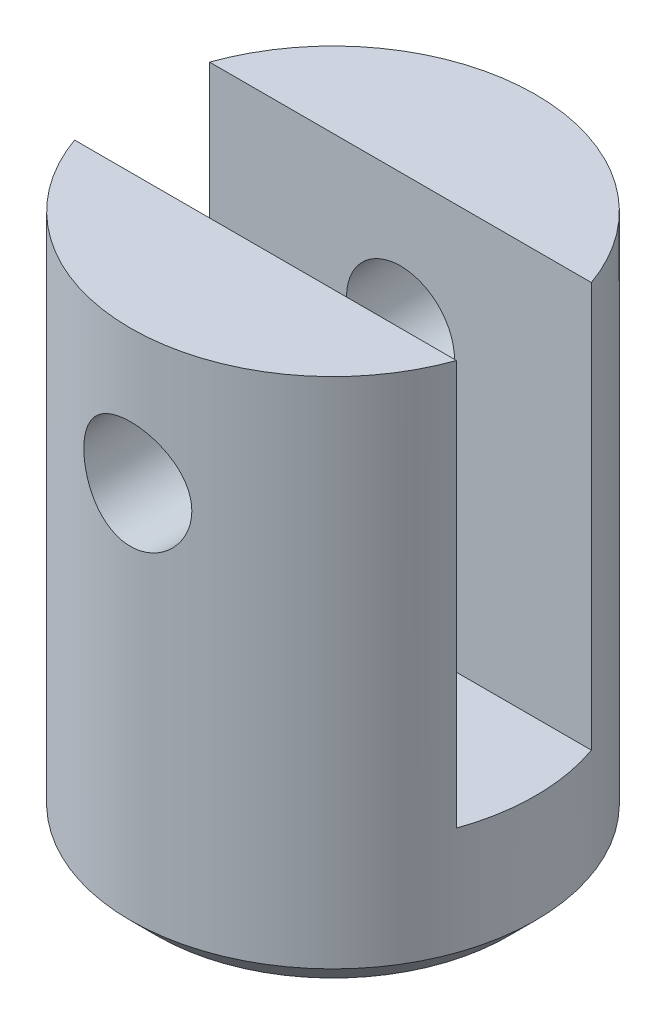
from build123d import *

# Parameters (mm, degrees)
ESBO_O1_R                  = 7.5
RESSALTO_EXTRUS_O1_DEPTH   = 10
CORTE_EXTRUS_O1_DEPTH      = 15.577379737
CORTE_EXTRUS_O1_DEPTH_BACK = 15.577379737
ESBO_O2_W                  = 5
ESBO_O2_H                  = 15
CORTE_EXTRUS_O2_DEPTH      = 15.577379737
CORTE_EXTRUS_O2_DEPTH_BACK = 15.577379737
ESBO_O3_R                  = 2
CHANFRO1_SIZE              = 1


with BuildPart() as part:
    # Esboço1 → Ressalto-extrusão1 (new, symmetric)
    with BuildSketch(Plane(origin=(0, 0, 0), x_dir=(1, 0, 0), z_dir=(0, 1, 0))):
        Circle(ESBO_O1_R)
    extrude(amount=RESSALTO_EXTRUS_O1_DEPTH, both=True)

    # Esboço2 → Corte-extrusão1 (cut, two sides: drawn at the far end of the back side and taken through both)
    with BuildSketch(Plane(origin=(0, 0, 0), x_dir=(0, 0, -1), z_dir=(1, 0, 0)).offset(-CORTE_EXTRUS_O1_DEPTH_BACK)):
        with Locations((0, 2.5)):
            Rectangle(ESBO_O2_W, ESBO_O2_H)
    extrude(amount=CORTE_EXTRUS_O1_DEPTH + CORTE_EXTRUS_O1_DEPTH_BACK, mode=Mode.SUBTRACT)

    # Esboço3 → Corte-extrusão2 (cut, two sides: drawn at the far end of the back side and taken through both)
    with BuildSketch(Plane.XY.offset(-CORTE_EXTRUS_O2_DEPTH_BACK)):
        with Locations((0, 5)):
            Circle(ESBO_O3_R)
    extrude(amount=CORTE_EXTRUS_O2_DEPTH + CORTE_EXTRUS_O2_DEPTH_BACK, mode=Mode.SUBTRACT)

    # Chanfro1
    chanfro1_edges = [part.edges().sort_by_distance(p)[0] for p in [
        (-7.5, -10, 0),
    ]]
    chamfer(chanfro1_edges, length=CHANFRO1_SIZE)


solid = part.part
